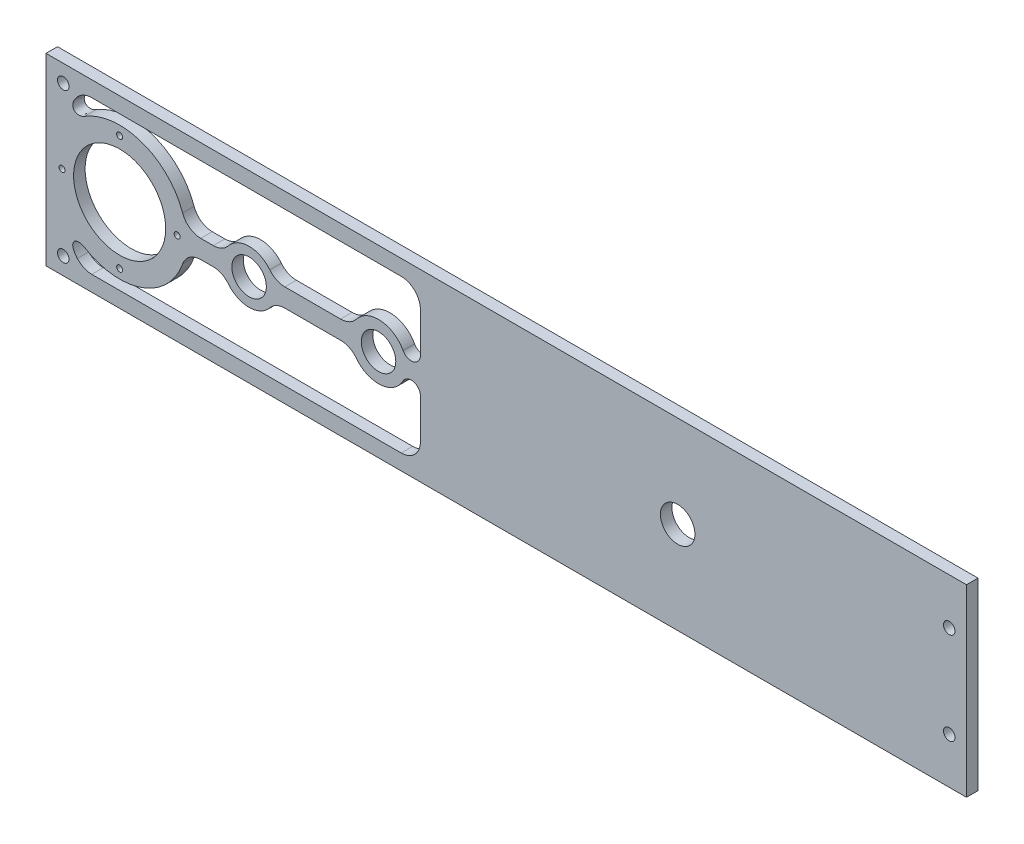
from build123d import *

# Parameters (mm, degrees)
SKETCH1_W           = 508
SKETCH1_H           = 101.6
BOSS_EXTRUDE1_DEPTH = 6.35
SKETCH2_R           = 25.4
SKETCH2_R_2         = 1.651
MOTOR_MOUNT_DEPTH   = 6.35
SKETCH3_R           = 9.525
CUT_EXTRUDE2_DEPTH  = 511.573170564
SKETCH4_R           = 3.175
CUT_EXTRUDE3_DEPTH  = 511.573170564
CUT_EXTRUDE4_DEPTH  = 511.573170564


with BuildPart() as part:
    # Sketch1 → Boss-Extrude1 (new body)
    with BuildSketch(Plane.XY):
        with Locations((254, 0)):
            Rectangle(SKETCH1_W, SKETCH1_H)
    extrude(amount=-BOSS_EXTRUDE1_DEPTH)

    # Sketch2 → Motor mount (cut)
    with BuildSketch(Plane.XY):
        with Locations((40.64, 0)):
            Circle(SKETCH2_R)
        with Locations((72.39, 0)):
            Circle(SKETCH2_R_2)
        with Locations((40.64, -31.75)):
            Circle(SKETCH2_R_2)
        with Locations((8.89, 0)):
            Circle(SKETCH2_R_2)
        with Locations((40.64, 31.75)):
            Circle(SKETCH2_R_2)
    extrude(amount=-MOTOR_MOUNT_DEPTH, mode=Mode.SUBTRACT)

    # Sketch3 → Cut-Extrude2 (cut, through all)
    with BuildSketch(Plane.XY):
        with Locations((112.0775, 0)):
            Circle(SKETCH3_R)
        with Locations((183.515, 0)):
            Circle(SKETCH3_R)
        with Locations((348.615, 0)):
            Circle(SKETCH3_R)
    extrude(amount=-CUT_EXTRUDE2_DEPTH, mode=Mode.SUBTRACT)

    # Sketch4 → Cut-Extrude3 (cut, through all)
    with BuildSketch(Plane.XY):
        with Locations((9.525, 41.275)):
            Circle(SKETCH4_R)
        with Locations((9.525, -41.275)):
            Circle(SKETCH4_R)
        with Locations((498.475, 25.4)):
            Circle(SKETCH4_R)
        with Locations((498.475, -25.4)):
            Circle(SKETCH4_R)
    extrude(amount=-CUT_EXTRUDE3_DEPTH, mode=Mode.SUBTRACT)

    # Sketch7 → Cut-Extrude4 (cut, through all)
    with BuildSketch(Plane.XY):
        with BuildLine():
            Line((85.406292789, 5.08), (92.341412089, 5.08))
            ThreePointArc((92.341412089, 5.08), (96.950572969, 6.134064693), (100.643442411, 9.08671294))
            ThreePointArc((100.643442411, 9.08671294), (112.0775, 14.605), (123.511557589, 9.08671294))
            ThreePointArc((123.511557589, 9.08671294), (127.204427031, 6.134064693), (131.813587911, 5.08))
            Line((131.813587911, 5.08), (162.585112959, 5.08))
            ThreePointArc((162.585112959, 5.08), (167.45975122, 6.214203951), (171.333000793, 9.383818205))
            ThreePointArc((171.333000793, 9.383818205), (184.777760897, 15.325227036), (197.068677539, 7.263261936))
            ThreePointArc((197.068677539, 7.263261936), (202.783248212, 4.735656121), (206.626270766, 9.662753319))
            Line((206.626270766, 9.662753319), (206.626270766, 31.603209647))
            ThreePointArc((206.626270766, 31.603209647), (203.520318205, 39.101642443), (196.02188541, 42.207595003))
            Line((196.02188541, 42.207595003), (25.263102588, 42.207595003))
            ThreePointArc((25.263102588, 42.207595003), (20.881723867, 41.260150637), (17.283250038, 38.587115578))
            add(Edge.make_bspline(
                [(17.283250038, 38.587115578), (11.530533455, 32.014027317), (16.787146308, 28.551640426), (21.263438452, 31.320883809)],
                knots=[0, 0, 0, 0, 1, 1, 1, 1], degree=3))
            ThreePointArc((21.263438452, 31.320883809), (52.918543043, 34.722993545), (75.39838363, 12.177999321))
            ThreePointArc((75.39838363, 12.177999321), (79.271558889, 7.034643814), (85.406292789, 5.08))
        make_face()
    cut_extrude4 = extrude(amount=-CUT_EXTRUDE4_DEPTH, mode=Mode.SUBTRACT)

    # Mirror1: Cut-Extrude4 across plane
    add(cut_extrude4.mirror(Plane.ZX), mode=Mode.SUBTRACT)


solid = part.part
